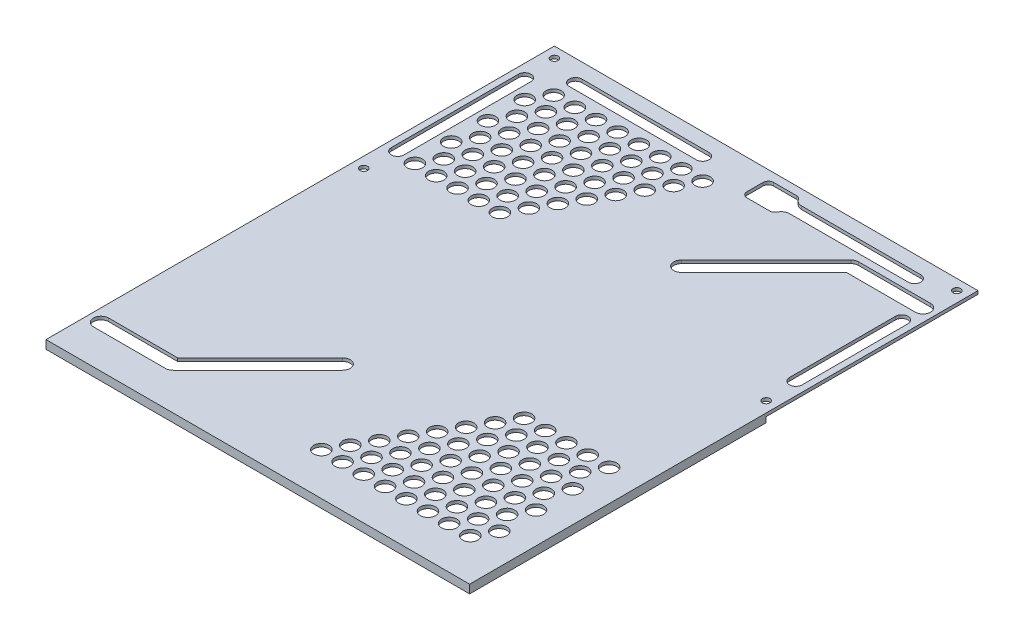
from build123d import *

# Parameters (mm, degrees)
SKETCH1_W               = 127
SKETCH1_H               = 152.4
BOSS_EXTRUDE1_DEPTH     = 2.54
SKETCH5_W               = 127
SKETCH5_H               = 63.5
CUT_EXTRUDE2_DEPTH      = 1.5875
CUT_EXTRUDE5_DEPTH      = 199.396601785
SKETCH10_R              = 2.286
CUT_EXTRUDE6_DEPTH      = 199.396601785
CUT_EXTRUDE7_DEPTH      = 199.396601785
CUT_EXTRUDE7_DEPTH_BACK = 199.396601785
CUT_EXTRUDE8_DEPTH      = 1.5875
CUT_EXTRUDE9_DEPTH      = 1.5875
SKETCH15_R              = 1.1303
CUT_EXTRUDE10_DEPTH     = 199.396601785
CUT_EXTRUDE11_DEPTH     = 199.396601785
CUT_EXTRUDE12_DEPTH     = 199.396601785
FILLET1_R               = 2.54


with BuildPart() as part:
    # Sketch1 → Boss-Extrude1 (new body)
    with BuildSketch(Plane(origin=(0, 0, 0), x_dir=(1, 0, 0), z_dir=(0, 1, 0))):
        with Locations((63.5, 76.2)):
            Rectangle(SKETCH1_W, SKETCH1_H)
    extrude(amount=BOSS_EXTRUDE1_DEPTH)

    # Sketch5 → Cut-Extrude2 (cut)
    with BuildSketch(Plane(origin=(0, 0, 0), x_dir=(1, 0, 0), z_dir=(0, 1, 0))):
        with Locations((63.5, 120.65)):
            Rectangle(SKETCH5_W, SKETCH5_H)
    extrude(amount=CUT_EXTRUDE2_DEPTH, mode=Mode.SUBTRACT)

    # Sketch9 → Cut-Extrude5 (cut, through all)
    with BuildSketch(Plane(origin=(0, 2.54, 0), x_dir=(1, 0, 0), z_dir=(0, 1, 0))):
        with BuildLine():
            Line((27.016446102, 11.083553898), (52.416446102, 36.483553898))
            ThreePointArc((52.416446102, 36.483553898), (52.416446102, 39.716446102), (49.183553898, 39.716446102))
            Line((49.183553898, 39.716446102), (24.453107796, 14.986))
            Line((24.453107796, 14.986), (3.81, 14.986))
            ThreePointArc((3.81, 14.986), (1.524, 12.7), (3.81, 10.414))
            Line((3.81, 10.414), (25.4, 10.414))
            ThreePointArc((25.4, 10.414), (26.274814326, 10.588011389), (27.016446102, 11.083553898))
        make_face()
        with BuildLine():
            Line((99.983553898, 141.316446102), (74.583553898, 115.916446102))
            ThreePointArc((74.583553898, 115.916446102), (74.583553898, 112.683553898), (77.816446102, 112.683553898))
            Line((77.816446102, 112.683553898), (102.546892204, 137.414))
            Line((102.546892204, 137.414), (123.19, 137.414))
            ThreePointArc((123.19, 137.414), (125.476, 139.7), (123.19, 141.986))
            Line((123.19, 141.986), (101.6, 141.986))
            ThreePointArc((101.6, 141.986), (100.725185674, 141.811988611), (99.983553898, 141.316446102))
        make_face()
    extrude(amount=-CUT_EXTRUDE5_DEPTH, mode=Mode.SUBTRACT)

    # Sketch10 → Cut-Extrude6 (cut, through all)
    with BuildSketch(Plane(origin=(0, 2.54, 0), x_dir=(1, 0, 0), z_dir=(0, 1, 0))):
        with Locations((82.55, 12.7)):
            Circle(SKETCH10_R)
        with Locations((85.727674349, 18.203893422)):
            Circle(SKETCH10_R)
        with Locations((88.905348698, 23.707786845)):
            Circle(SKETCH10_R)
        with Locations((92.083023047, 29.211680267)):
            Circle(SKETCH10_R)
        with Locations((95.260697396, 34.71557369)):
            Circle(SKETCH10_R)
        with Locations((98.438371745, 40.219467112)):
            Circle(SKETCH10_R)
        with Locations((101.616046094, 45.723360535)):
            Circle(SKETCH10_R)
        with Locations((104.793720443, 51.227253957)):
            Circle(SKETCH10_R)
        with Locations((92.124458299, 18.203893422)):
            Circle(SKETCH10_R)
        with Locations((95.302132648, 23.707786845)):
            Circle(SKETCH10_R)
        with Locations((98.479806997, 29.211680267)):
            Circle(SKETCH10_R)
        with Locations((101.657481346, 34.71557369)):
            Circle(SKETCH10_R)
        with Locations((104.835155695, 40.219467112)):
            Circle(SKETCH10_R)
        with Locations((108.012830044, 45.723360535)):
            Circle(SKETCH10_R)
        with Locations((111.190504393, 51.227253957)):
            Circle(SKETCH10_R)
        with Locations((88.94678395, 12.7)):
            Circle(SKETCH10_R)
        with Locations((98.521242248, 18.203893422)):
            Circle(SKETCH10_R)
        with Locations((101.698916597, 23.707786845)):
            Circle(SKETCH10_R)
        with Locations((104.876590946, 29.211680267)):
            Circle(SKETCH10_R)
        with Locations((108.054265295, 34.71557369)):
            Circle(SKETCH10_R)
        with Locations((111.231939644, 40.219467112)):
            Circle(SKETCH10_R)
        with Locations((114.409613993, 45.723360535)):
            Circle(SKETCH10_R)
        with Locations((117.587288342, 51.227253957)):
            Circle(SKETCH10_R)
        with Locations((95.343567899, 12.7)):
            Circle(SKETCH10_R)
        with Locations((101.810527773, 12.7)):
            Circle(SKETCH10_R)
        with Locations((104.988202122, 18.203893422)):
            Circle(SKETCH10_R)
        with Locations((108.165876471, 23.707786845)):
            Circle(SKETCH10_R)
        with Locations((111.34355082, 29.211680267)):
            Circle(SKETCH10_R)
        with Locations((114.521225169, 34.71557369)):
            Circle(SKETCH10_R)
        with Locations((117.698899518, 40.219467112)):
            Circle(SKETCH10_R)
        with Locations((108.160527773, 12.7)):
            Circle(SKETCH10_R)
        with Locations((111.338202122, 18.203893422)):
            Circle(SKETCH10_R)
        with Locations((114.515876471, 23.707786845)):
            Circle(SKETCH10_R)
        with Locations((117.69355082, 29.211680267)):
            Circle(SKETCH10_R)
        with Locations((114.510527773, 12.7)):
            Circle(SKETCH10_R)
        with Locations((117.688202122, 18.203893422)):
            Circle(SKETCH10_R)
        with Locations((44.58196276, 139.566077757)):
            Circle(SKETCH10_R)
        with Locations((41.404288411, 134.062184334)):
            Circle(SKETCH10_R)
        with Locations((38.226614062, 128.558290912)):
            Circle(SKETCH10_R)
        with Locations((35.048939713, 123.054397489)):
            Circle(SKETCH10_R)
        with Locations((31.871265364, 117.550504067)):
            Circle(SKETCH10_R)
        with Locations((28.693591015, 112.046610644)):
            Circle(SKETCH10_R)
        with Locations((25.515916666, 106.542717222)):
            Circle(SKETCH10_R)
        with Locations((22.338242317, 101.038823799)):
            Circle(SKETCH10_R)
        with Locations((35.007504462, 134.062184334)):
            Circle(SKETCH10_R)
        with Locations((31.829830113, 128.558290912)):
            Circle(SKETCH10_R)
        with Locations((28.652155764, 123.054397489)):
            Circle(SKETCH10_R)
        with Locations((25.474481415, 117.550504067)):
            Circle(SKETCH10_R)
        with Locations((22.296807066, 112.046610644)):
            Circle(SKETCH10_R)
        with Locations((19.119132717, 106.542717222)):
            Circle(SKETCH10_R)
        with Locations((15.941458367, 101.038823799)):
            Circle(SKETCH10_R)
        with Locations((38.185178811, 139.566077757)):
            Circle(SKETCH10_R)
        with Locations((28.610720512, 134.062184334)):
            Circle(SKETCH10_R)
        with Locations((25.433046163, 128.558290912)):
            Circle(SKETCH10_R)
        with Locations((22.255371814, 123.054397489)):
            Circle(SKETCH10_R)
        with Locations((19.077697465, 117.550504067)):
            Circle(SKETCH10_R)
        with Locations((15.900023116, 112.046610644)):
            Circle(SKETCH10_R)
        with Locations((12.722348767, 106.542717222)):
            Circle(SKETCH10_R)
        with Locations((9.544674418, 101.038823799)):
            Circle(SKETCH10_R)
        with Locations((31.788394861, 139.566077757)):
            Circle(SKETCH10_R)
        with Locations((25.321434988, 139.566077757)):
            Circle(SKETCH10_R)
        with Locations((22.143760639, 134.062184334)):
            Circle(SKETCH10_R)
        with Locations((18.966086289, 128.558290912)):
            Circle(SKETCH10_R)
        with Locations((15.78841194, 123.054397489)):
            Circle(SKETCH10_R)
        with Locations((12.610737591, 117.550504067)):
            Circle(SKETCH10_R)
        with Locations((9.433063242, 112.046610644)):
            Circle(SKETCH10_R)
        with Locations((18.971434988, 139.566077757)):
            Circle(SKETCH10_R)
        with Locations((15.793760639, 134.062184334)):
            Circle(SKETCH10_R)
        with Locations((12.616086289, 128.558290912)):
            Circle(SKETCH10_R)
        with Locations((9.43841194, 123.054397489)):
            Circle(SKETCH10_R)
        with Locations((12.621434988, 139.566077757)):
            Circle(SKETCH10_R)
        with Locations((9.443760639, 134.062184334)):
            Circle(SKETCH10_R)
        with Locations((76.2, 12.7)):
            Circle(SKETCH10_R)
        with Locations((79.377674349, 18.203893422)):
            Circle(SKETCH10_R)
        with Locations((82.555348698, 23.707786845)):
            Circle(SKETCH10_R)
        with Locations((85.733023047, 29.211680267)):
            Circle(SKETCH10_R)
        with Locations((88.910697396, 34.71557369)):
            Circle(SKETCH10_R)
        with Locations((92.088371745, 40.219467112)):
            Circle(SKETCH10_R)
        with Locations((95.266046094, 45.723360535)):
            Circle(SKETCH10_R)
        with Locations((98.443720443, 51.227253957)):
            Circle(SKETCH10_R)
        with Locations((69.85, 12.7)):
            Circle(SKETCH10_R)
        with Locations((73.027674349, 18.203893422)):
            Circle(SKETCH10_R)
        with Locations((76.205348698, 23.707786845)):
            Circle(SKETCH10_R)
        with Locations((79.383023047, 29.211680267)):
            Circle(SKETCH10_R)
        with Locations((82.560697396, 34.71557369)):
            Circle(SKETCH10_R)
        with Locations((85.738371745, 40.219467112)):
            Circle(SKETCH10_R)
        with Locations((88.916046094, 45.723360535)):
            Circle(SKETCH10_R)
        with Locations((92.093720443, 51.227253957)):
            Circle(SKETCH10_R)
        with Locations((28.688242317, 101.038823799)):
            Circle(SKETCH10_R)
        with Locations((31.865916666, 106.542717222)):
            Circle(SKETCH10_R)
        with Locations((35.043591015, 112.046610644)):
            Circle(SKETCH10_R)
        with Locations((38.221265364, 117.550504067)):
            Circle(SKETCH10_R)
        with Locations((41.398939713, 123.054397489)):
            Circle(SKETCH10_R)
        with Locations((44.576614062, 128.558290912)):
            Circle(SKETCH10_R)
        with Locations((47.754288411, 134.062184334)):
            Circle(SKETCH10_R)
        with Locations((50.93196276, 139.566077757)):
            Circle(SKETCH10_R)
        with Locations((35.038242317, 101.038823799)):
            Circle(SKETCH10_R)
        with Locations((38.215916666, 106.542717222)):
            Circle(SKETCH10_R)
        with Locations((41.393591015, 112.046610644)):
            Circle(SKETCH10_R)
        with Locations((44.571265364, 117.550504067)):
            Circle(SKETCH10_R)
        with Locations((47.748939713, 123.054397489)):
            Circle(SKETCH10_R)
        with Locations((50.926614062, 128.558290912)):
            Circle(SKETCH10_R)
        with Locations((54.104288411, 134.062184334)):
            Circle(SKETCH10_R)
        with Locations((57.28196276, 139.566077757)):
            Circle(SKETCH10_R)
    extrude(amount=-CUT_EXTRUDE6_DEPTH, mode=Mode.SUBTRACT)

    # Sketch12 → Cut-Extrude7 (cut, two sides: drawn at the far end of the back side and taken through both)
    with BuildSketch(Plane(origin=(0, 2.54, 0), x_dir=(1, 0, 0), z_dir=(0, 1, 0)).offset(-CUT_EXTRUDE7_DEPTH_BACK)):
        with BuildLine():
            Line((76.2, 147.955), (114.3, 147.955))
            ThreePointArc((114.3, 147.955), (116.205, 146.05), (114.3, 144.145))
            Line((114.3, 144.145), (76.2, 144.145))
            ThreePointArc((76.2, 144.145), (74.295, 146.05), (76.2, 147.955))
        make_face()
        with BuildLine():
            Line((50.8, 147.955), (12.7, 147.955))
            ThreePointArc((12.7, 147.955), (10.795, 146.05), (12.7, 144.145))
            Line((12.7, 144.145), (50.8, 144.145))
            ThreePointArc((50.8, 144.145), (52.705, 146.05), (50.8, 147.955))
        make_face()
        with BuildLine():
            Line((5.715, 139.7), (5.715, 101.6))
            ThreePointArc((5.715, 101.6), (3.81, 99.695), (1.905, 101.6))
            Line((1.905, 101.6), (1.905, 139.7))
            ThreePointArc((1.905, 139.7), (3.81, 141.605), (5.715, 139.7))
        make_face()
    extrude(amount=CUT_EXTRUDE7_DEPTH + CUT_EXTRUDE7_DEPTH_BACK, mode=Mode.SUBTRACT)

    # Sketch13 → Cut-Extrude8 (cut)
    with BuildSketch(Plane.XZ):
        with BuildLine():
            Line((23.427307909, -17.4625), (47.432403955, -41.467596045))
            ThreePointArc((47.432403955, -41.467596045), (54.167596045, -41.467596045), (54.167596045, -34.732403955))
            Line((54.167596045, -34.732403955), (28.767596045, -9.332403955))
            ThreePointArc((28.767596045, -9.332403955), (27.222529847, -8.300023726), (25.4, -7.9375))
            Line((25.4, -7.9375), (3.81, -7.9375))
            ThreePointArc((3.81, -7.9375), (-0.9525, -12.7), (3.81, -17.4625))
            Line((3.81, -17.4625), (23.427307909, -17.4625))
        make_face()
    extrude(amount=-CUT_EXTRUDE8_DEPTH, mode=Mode.SUBTRACT)

    # Sketch14 → Cut-Extrude9 (cut)
    with BuildSketch(Plane.XZ):
        with BuildLine():
            Line((65.725554014, -15.08125), (87.969274458, -53.608503957))
            ThreePointArc((87.969274458, -53.608503957), (89.712470443, -55.351699943), (92.093720443, -55.989753957))
            Line((92.093720443, -55.989753957), (117.587288342, -55.989753957))
            ThreePointArc((117.587288342, -55.989753957), (120.949735074, -54.599991455), (122.349766106, -51.24180728))
            Line((122.349766106, -51.24180728), (122.450679886, -18.218446745))
            ThreePointArc((122.450679886, -18.218446745), (122.209317916, -16.70692374), (121.500931037, -15.3500356))
            Line((121.500931037, -15.3500356), (118.683035071, -10.404005859))
            ThreePointArc((118.683035071, -10.404005859), (116.934030832, -8.600239132), (114.510527773, -7.9375))
            Line((114.510527773, -7.9375), (69.85, -7.9375))
            ThreePointArc((69.85, -7.9375), (65.725554014, -10.31875), (65.725554014, -15.08125))
        make_face()
    extrude(amount=-CUT_EXTRUDE9_DEPTH, mode=Mode.SUBTRACT)

    # Sketch15 → Cut-Extrude10 (cut, through all)
    with BuildSketch(Plane(origin=(0, 2.54, 0), x_dir=(1, 0, 0), z_dir=(0, 1, 0))):
        with Locations((3.175, 149.225)):
            Circle(SKETCH15_R)
        with Locations((3.175, 92.075)):
            Circle(SKETCH15_R)
        with Locations((123.825, 92.075)):
            Circle(SKETCH15_R)
        with Locations((123.825, 149.225)):
            Circle(SKETCH15_R)
    extrude(amount=-CUT_EXTRUDE10_DEPTH, mode=Mode.SUBTRACT)

    # Sketch16 → Cut-Extrude11 (cut, through all)
    with BuildSketch(Plane(origin=(0, 2.54, 0), x_dir=(1, 0, 0), z_dir=(0, 1, 0))):
        with BuildLine():
            Line((121.285, 101.6), (121.285, 133.35))
            ThreePointArc((121.285, 133.35), (123.19, 135.255), (125.095, 133.35))
            Line((125.095, 133.35), (125.095, 101.6))
            ThreePointArc((125.095, 101.6), (123.19, 99.695), (121.285, 101.6))
        make_face()
    extrude(amount=-CUT_EXTRUDE11_DEPTH, mode=Mode.SUBTRACT)

    # Sketch17 → Cut-Extrude12 (cut, through all)
    with BuildSketch(Plane(origin=(0, 2.54, 0), x_dir=(1, 0, 0), z_dir=(0, 1, 0))):
        with BuildLine():
            Line((75.0875, 149.86), (68.2625, 149.86))
            ThreePointArc((68.2625, 149.86), (67.139967985, 149.395032015), (66.675, 148.2725))
            Line((66.675, 148.2725), (66.675, 143.4475))
            ThreePointArc((66.675, 143.4475), (67.139967985, 142.324967985), (68.2625, 141.86))
            Line((68.2625, 141.86), (75.0875, 141.86))
            ThreePointArc((75.0875, 141.86), (76.210032015, 142.324967985), (76.675, 143.4475))
            Line((76.675, 143.4475), (76.675, 148.2725))
            ThreePointArc((76.675, 148.2725), (76.210032015, 149.395032015), (75.0875, 149.86))
        make_face()
    extrude(amount=-CUT_EXTRUDE12_DEPTH, mode=Mode.SUBTRACT)

    # Fillet1
    fillet1_edges = [part.edges().sort_by_distance(p)[0] for p in [
        (76.675, 2.06375, -147.955),
        (76.675, 2.06375, -144.145),
    ]]
    fillet(fillet1_edges, radius=FILLET1_R)


solid = part.part
